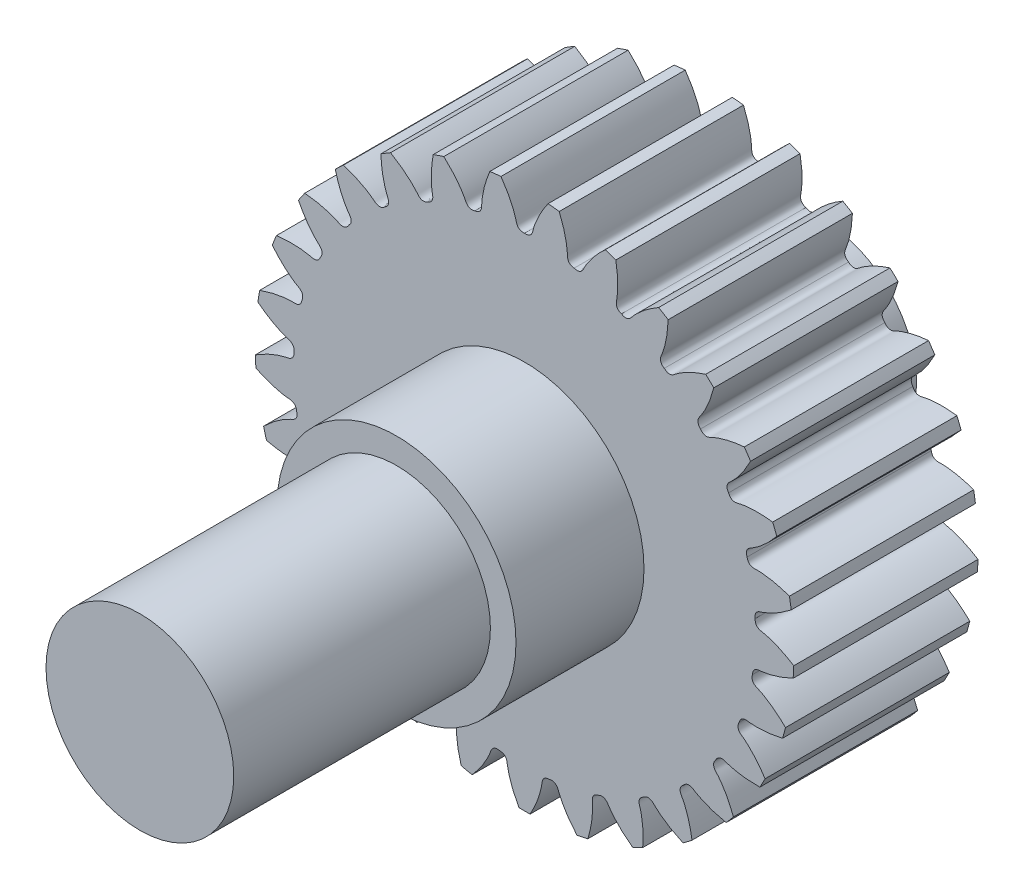
from build123d import *

# Parameters (mm, degrees)
GEAR_BASESKETCH_R                         = 9.46974028
NON_STANDARD_PITCHES_0_6856IN_P_D_DEPTH   = 3.2385
TOOTH_CUT_START                           = -3.2385
TOOTH_CUT_D_P_42_3000_P_A_20_000DEG_DEPTH = 6.477
TOOTH_PATTERN_29_29_COUNT                 = 29
EXTRUDE1_DEPTH                            = 4
EXTRUDE1_DEPTH_BACK                       = 20
SKETCH1_R                                 = 3.3
SKETCH2_R                                 = 5
EXTRUDE2_DEPTH                            = 0.2
SKETCH3_R                                 = 4.2
EXTRUDE3_DEPTH                            = 4.5


# Read off the part's stored shape, not the designer's step: Tooth-Cut, D.P.=42.3000, P.A.=20.000deg
with BuildPart() as part:
    # Gear-BaseSketch → Non-standard pitches, 0.6856in P.D. (new, symmetric)
    with BuildSketch(Plane.XY):
        Circle(GEAR_BASESKETCH_R)
    extrude(amount=NON_STANDARD_PITCHES_0_6856IN_P_D_DEPTH, both=True)

    # Tooth-Cut_ D.P._42.3000_ P.A._20.000 2 → Tooth-Cut, D.P.=42.3000, P.A.=20.000deg (cut)
    with BuildSketch(Plane.XY.offset(TOOTH_CUT_START)):
        with BuildLine():
            ThreePointArc((0.82835354, 9.433441121), (0, 9.46974028), (-0.82835354, 9.433441121))
            add(Edge.make_bspline(
                [(-0.82835354, 9.433441121), (-0.817072316, 9.41748735), (-0.790774148, 9.379724929), (-0.750624058, 9.32034658), (-0.708629377, 9.255821878), (-0.669048304, 9.192656019), (-0.631827539, 9.130907923), (-0.596904196, 9.070640857), (-0.564216029, 9.011914855), (-0.533698875, 8.954788611), (-0.505287362, 8.89931896), (-0.478914774, 8.845560973), (-0.454513143, 8.793567901), (-0.432013277, 8.74339115), (-0.411344811, 8.695080256), (-0.39243624, 8.648682863), (-0.375214991, 8.604244691), (-0.359607385, 8.561809533), (-0.345538958, 8.521419166), (-0.332933567, 8.483113557), (-0.32171665, 8.446930076), (-0.311804347, 8.412906061), (-0.303140431, 8.381070108), (-0.295831005, 8.352481075), (-0.290504864, 8.329492226), (-0.285849661, 8.311608172), (-0.281483586, 8.297014986), (-0.276579329, 8.282538213), (-0.271017073, 8.268084496), (-0.26465087, 8.253539297), (-0.257269148, 8.238773824), (-0.248576029, 8.22365095), (-0.238157676, 8.208045995), (-0.225447152, 8.191891936), (-0.209699633, 8.175271046), (-0.190024249, 8.158564489), (-0.165534389, 8.142687663), (-0.135789116, 8.129137162), (-0.080384574, 8.11505489), (-0.034159201, 8.116976605), (0, 8.118396696)],
                knots=[0.061712082, 0.061712082, 0.061712082, 0.061712082, 0.095341533, 0.140909178, 0.185074741, 0.227838223, 0.269199623, 0.309158942, 0.34771618, 0.384871336, 0.420624411, 0.454975405, 0.487924317, 0.519471148, 0.549615898, 0.578358566, 0.605699153, 0.631637658, 0.656174082, 0.679308425, 0.701040686, 0.721370866, 0.740298965, 0.757824982, 0.772154928, 0.780911648, 0.789626452, 0.798365646, 0.807212686, 0.816273321, 0.825682184, 0.835610795, 0.846276279, 0.857948198, 0.870946897, 0.885619352, 0.902269475, 0.921021534, 0.941637221, 1, 1, 1, 1], degree=3))
            add(Edge.make_bspline(
                [(0, 8.118396696), (0.034159201, 8.116976605), (0.080384574, 8.11505489), (0.135789116, 8.129137162), (0.165534389, 8.142687663), (0.190024249, 8.158564489), (0.209699633, 8.175271046), (0.225447152, 8.191891936), (0.238157676, 8.208045995), (0.248576029, 8.22365095), (0.257269148, 8.238773824), (0.26465087, 8.253539297), (0.271017073, 8.268084496), (0.276579329, 8.282538213), (0.281483586, 8.297014986), (0.285849661, 8.311608172), (0.290504864, 8.329492226), (0.295831005, 8.352481075), (0.303140431, 8.381070108), (0.311804347, 8.412906061), (0.32171665, 8.446930076), (0.332933567, 8.483113557), (0.345538958, 8.521419166), (0.359607385, 8.561809533), (0.375214991, 8.604244691), (0.39243624, 8.648682863), (0.411344811, 8.695080256), (0.432013277, 8.74339115), (0.454513143, 8.793567901), (0.478914774, 8.845560973), (0.505287362, 8.89931896), (0.533698875, 8.954788611), (0.564216029, 9.011914855), (0.596904196, 9.070640857), (0.631827539, 9.130907923), (0.669048304, 9.192656019), (0.708629377, 9.255821878), (0.750624058, 9.32034658), (0.790774148, 9.379724929), (0.817072316, 9.41748735), (0.82835354, 9.433441121)],
                knots=[0, 0, 0, 0, 0.058362779, 0.078978466, 0.097730525, 0.114380648, 0.129053103, 0.142051802, 0.153723721, 0.164389205, 0.174317816, 0.183726679, 0.192787314, 0.201634354, 0.210373548, 0.219088352, 0.227845072, 0.242175018, 0.259701035, 0.278629134, 0.298959314, 0.320691575, 0.343825918, 0.368362342, 0.394300847, 0.421641434, 0.450384102, 0.480528852, 0.512075683, 0.545024595, 0.579375589, 0.615128664, 0.65228382, 0.690841058, 0.730800377, 0.772161777, 0.814925259, 0.859090822, 0.904658467, 0.938287918, 0.938287918, 0.938287918, 0.938287918], degree=3))
        make_face()
    tooth_cut_d_p_42_3000_p_a_20_000deg = extrude(amount=TOOTH_CUT_D_P_42_3000_P_A_20_000DEG_DEPTH, mode=Mode.SUBTRACT)

    # Tooth Pattern, 29 / 29: Tooth-Cut, D.P.=42.3000, P.A.=20.000deg ×29 about axis
    tooth_pattern_29_29_axis = Axis((0, 0, -88.99), (0, 0, 1))
    for i in range(1, TOOTH_PATTERN_29_29_COUNT):
        add(tooth_cut_d_p_42_3000_p_a_20_000deg.rotate(tooth_pattern_29_29_axis, i * 360 / TOOTH_PATTERN_29_29_COUNT), mode=Mode.SUBTRACT)

    # Sketch1 → Extrude1 (add, two sides: drawn at the far end of the back side and taken through both)
    with BuildSketch(Plane(origin=(0, 0, -3.2385), x_dir=(-1, 0, 0), z_dir=(0, 0, -1)).offset(-EXTRUDE1_DEPTH_BACK)):
        with Locations(Location((0, 0, 0), (0, 0, 180))):
            Circle(SKETCH1_R)
    extrude(amount=EXTRUDE1_DEPTH + EXTRUDE1_DEPTH_BACK)

    # Sketch2 → Extrude2 (add)
    with BuildSketch(Plane(origin=(0, 0, -3.2385), x_dir=(-1, 0, 0), z_dir=(0, 0, -1))):
        with Locations(Location((0, 0, 0), (0, 0, 180))):
            Circle(SKETCH2_R)
    extrude(amount=EXTRUDE2_DEPTH)

    # Sketch3 → Extrude3 (add)
    with BuildSketch(Plane.XY.offset(3.2385)):
        Circle(SKETCH3_R)
    extrude(amount=EXTRUDE3_DEPTH)


solid = part.part
